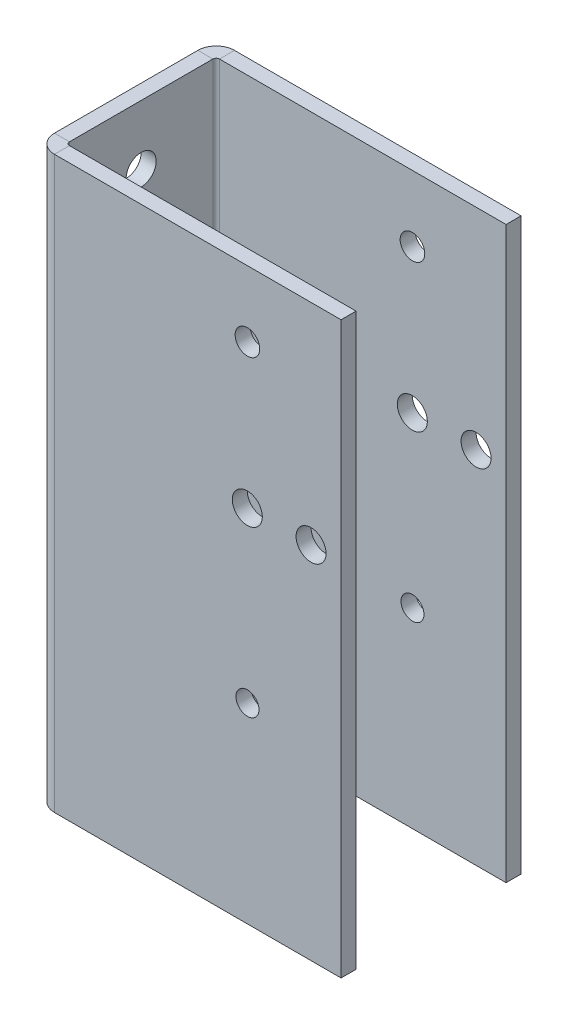
from build123d import *

# Parameters (mm, degrees)
BASE_FLANGE1_DEPTH = 76
CUT_EXTRUDE1_REACH = 84.503
SKETCH2_R          = 1.640689261
SKETCH2_R_2        = 1.533997934
SKETCH2_R_3        = 2
CUT_EXTRUDE2_REACH = 88.104
SKETCH3_R          = 2


# Sheet-metal steps are written as plain solids
with BuildPart() as part:
    # Sketch1 → Base-Flange1 (new body)
    with BuildSketch(Plane(origin=(0, 0, 0), x_dir=(1, 0, 0), z_dir=(0, 1, 0))):
        with BuildLine():
            Line((19.325, -10), (-18.885, -10))
            ThreePointArc((-18.885, -10), (-19.196126984, -9.871126984), (-19.325, -9.56))
            Line((-19.325, -9.56), (-19.325, 9.56))
            ThreePointArc((-19.325, 9.56), (-19.196126984, 9.871126984), (-18.885, 10))
            Line((-18.885, 10), (19.325, 10))
            Line((19.325, 10), (19.325, 12))
            Line((19.325, 12), (-18.885, 12))
            ThreePointArc((-18.885, 12), (-20.610340546, 11.285340546), (-21.325, 9.56))
            Line((-21.325, 9.56), (-21.325, -9.56))
            ThreePointArc((-21.325, -9.56), (-20.610340546, -11.285340546), (-18.885, -12))
            Line((-18.885, -12), (19.325, -12))
            Line((19.325, -12), (19.325, -10))
        make_face()
    extrude(amount=BASE_FLANGE1_DEPTH)

    # Cut-Extrude1: up to this face of the body (flat: up to its plane)
    cut_extrude1_end = Plane(part.part.faces().sort_by_distance((0.22, 38, 12))[0])
    # Sketch2 → Cut-Extrude1 (cut, up to the picked face)
    with BuildSketch(Plane(origin=(0, 0, -12), x_dir=(-1, 0, 0), z_dir=(0, 0, -1)), mode=Mode.PRIVATE) as cut_extrude1_sk1:
        with Locations((-6.845, 67.2)):
            Circle(SKETCH2_R)
    cut_extrude1_tool1 = split(extrude(cut_extrude1_sk1.sketch, amount=-CUT_EXTRUDE1_REACH, mode=Mode.PRIVATE), bisect_by=cut_extrude1_end, keep=Keep.BOTH, mode=Mode.PRIVATE)
    # Sketch2 → Cut-Extrude1 (cut, up to the picked face)
    with BuildSketch(Plane(origin=(0, 0, -12), x_dir=(-1, 0, 0), z_dir=(0, 0, -1)), mode=Mode.PRIVATE) as cut_extrude1_sk2:
        with Locations((-6.845, 25.5)):
            Circle(SKETCH2_R_2)
    cut_extrude1_tool2 = split(extrude(cut_extrude1_sk2.sketch, amount=-CUT_EXTRUDE1_REACH, mode=Mode.PRIVATE), bisect_by=cut_extrude1_end, keep=Keep.BOTH, mode=Mode.PRIVATE)
    # Sketch2 → Cut-Extrude1 (cut, up to the picked face)
    with BuildSketch(Plane(origin=(0, 0, -12), x_dir=(-1, 0, 0), z_dir=(0, 0, -1)), mode=Mode.PRIVATE) as cut_extrude1_sk3:
        with Locations((-6.825, 48)):
            Circle(SKETCH2_R_3)
    cut_extrude1_tool3 = split(extrude(cut_extrude1_sk3.sketch, amount=-CUT_EXTRUDE1_REACH, mode=Mode.PRIVATE), bisect_by=cut_extrude1_end, keep=Keep.BOTH, mode=Mode.PRIVATE)
    # Sketch2 → Cut-Extrude1 (cut, up to the picked face)
    with BuildSketch(Plane(origin=(0, 0, -12), x_dir=(-1, 0, 0), z_dir=(0, 0, -1)), mode=Mode.PRIVATE) as cut_extrude1_sk4:
        with Locations((-15.325, 48)):
            Circle(SKETCH2_R_3)
    cut_extrude1_tool4 = split(extrude(cut_extrude1_sk4.sketch, amount=-CUT_EXTRUDE1_REACH, mode=Mode.PRIVATE), bisect_by=cut_extrude1_end, keep=Keep.BOTH, mode=Mode.PRIVATE)
    add(cut_extrude1_tool1.solids().sort_by(Axis((6.845, 67.2, -12), (0, 0, 1)))[0], mode=Mode.SUBTRACT)
    add(cut_extrude1_tool2.solids().sort_by(Axis((6.845, 25.5, -12), (0, 0, 1)))[0], mode=Mode.SUBTRACT)
    add(cut_extrude1_tool3.solids().sort_by(Axis((6.825, 48, -12), (0, 0, 1)))[0], mode=Mode.SUBTRACT)
    add(cut_extrude1_tool4.solids().sort_by(Axis((15.325, 48, -12), (0, 0, 1)))[0], mode=Mode.SUBTRACT)

    # Sketch3 → Cut-Extrude2 (cut, up to next)
    with BuildSketch(Plane(origin=(-19.325, 0, 0), x_dir=(0, 0, -1), z_dir=(1, 0, 0)), mode=Mode.PRIVATE) as cut_extrude2_sk1:
        with Locations((0, 68)):
            Circle(SKETCH3_R)
    cut_extrude2_tool1 = extrude(cut_extrude2_sk1.sketch, amount=-CUT_EXTRUDE2_REACH, mode=Mode.PRIVATE) & part.part
    # Sketch3 → Cut-Extrude2 (cut, up to next)
    with BuildSketch(Plane(origin=(-19.325, 0, 0), x_dir=(0, 0, -1), z_dir=(1, 0, 0)), mode=Mode.PRIVATE) as cut_extrude2_sk2:
        with Locations((0, 8)):
            Circle(SKETCH3_R)
    cut_extrude2_tool2 = extrude(cut_extrude2_sk2.sketch, amount=-CUT_EXTRUDE2_REACH, mode=Mode.PRIVATE) & part.part
    add(cut_extrude2_tool1.solids().sort_by_distance((-19.325, 68, 0))[0], mode=Mode.SUBTRACT)
    add(cut_extrude2_tool2.solids().sort_by_distance((-19.325, 8, 0))[0], mode=Mode.SUBTRACT)


solid = part.part
